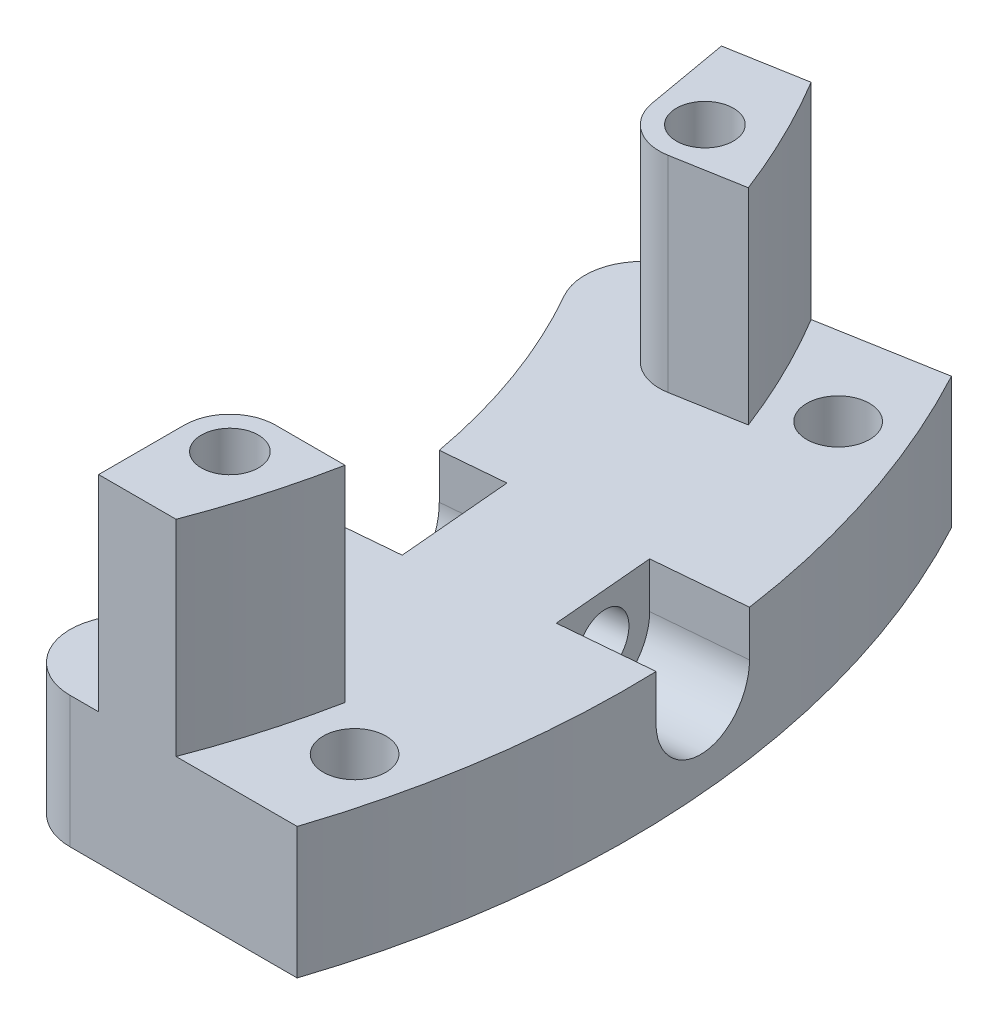
from build123d import *

# Parameters (mm, degrees)
BOSS_EXTRUDE1_DEPTH = 11.5
SKETCH4_R           = 4.5
CUT_EXTRUDE2_DEPTH  = 5
SKETCH5_R           = 2.75
CUT_EXTRUDE3_DEPTH  = 89.726115198
SKETCH6_R           = 2.5
CUT_EXTRUDE4_DEPTH  = 50.330582837
CUT_EXTRUDE5_DEPTH  = 8.2
CUT_EXTRUDE6_DEPTH  = 9
FILLET1_R           = 5.05
FILLET2_R           = 5
BOSS_EXTRUDE2_DEPTH = 18
SKETCH3_R           = 2.5
CUT_EXTRUDE1_DEPTH  = 4


with BuildPart() as part:
    # Sketch1 → Boss-Extrude1 (new body)
    with BuildSketch(Plane(origin=(0, 0, 0), x_dir=(1, 0, 0), z_dir=(0, 1, 0))):
        with BuildLine():
            Line((48.493420768, -25), (75.993420768, -25))
            ThreePointArc((75.993420768, -25), (79.695575847, 6.97245942), (70.497705508, 37.816312856))
            Line((70.497705508, 37.816312856), (43.415492301, 33.04098797))
            ThreePointArc((43.415492301, 33.04098797), (54.350723514, 4.755072162), (48.493420768, -25))
        make_face()
    extrude(amount=BOSS_EXTRUDE1_DEPTH)

    # Sketch4 → Cut-Extrude2 (cut)
    with BuildSketch(Plane.XZ):
        with Locations(Location((73.026415161, 17, 0), (0, 0, 270))):
            Circle(SKETCH4_R)
        with Locations(Location((68.964960805, -29.422635715, 0), (0, 0, 270))):
            Circle(SKETCH4_R)
    extrude(amount=-CUT_EXTRUDE2_DEPTH, mode=Mode.SUBTRACT)

    # Sketch5 → Cut-Extrude3 (cut, through all)
    with BuildSketch(Plane.XZ.offset(-5)):
        with Locations(Location((73.026415161, 17, 0), (0, 0, 270))):
            Circle(SKETCH5_R)
        with Locations(Location((68.964960805, -29.422635715, 0), (0, 0, 270))):
            Circle(SKETCH5_R)
    extrude(amount=-CUT_EXTRUDE3_DEPTH, mode=Mode.SUBTRACT)

    # Sketch6 → Cut-Extrude4 (cut, through all)
    with BuildSketch(Plane(origin=(45.954456534, 0, -4.020493985), x_dir=(0.08715574274765857, 0, 0.9961946980917455), z_dir=(-0.9961946980917455, 0, 0.08715574274765857))):
        with Locations((0, 7.5)):
            Circle(SKETCH6_R)
    extrude(amount=-CUT_EXTRUDE4_DEPTH, mode=Mode.SUBTRACT)

    # Sketch8 → Cut-Extrude5 (cut)
    with BuildSketch(Plane(origin=(79.695575847, 0, -6.97245942), x_dir=(-0.08715574274765857, 0, -0.9961946980917455), z_dir=(0.9961946980917455, 0, -0.08715574274765857))):
        with BuildLine():
            Line((-4.5, 7.5), (-4.5, 11.5))
            Line((-4.5, 11.5), (4.5, 11.5))
            Line((4.5, 11.5), (4.5, 7.5))
            ThreePointArc((4.5, 7.5), (0, 3), (-4.5, 7.5))
        make_face()
    extrude(amount=-CUT_EXTRUDE5_DEPTH, mode=Mode.SUBTRACT)

    # Sketch7 → Cut-Extrude6 (cut)
    with BuildSketch(Plane(origin=(0, 11.5, 0), x_dir=(1, 0, 0), z_dir=(0, 1, 0))):
        Polygon((51.16274886, 9.5454507), (52.043021862, -0.516115751), (60.012579447, 0.181130191), (59.132306445, 10.242696642), align=None)
    extrude(amount=-CUT_EXTRUDE6_DEPTH, mode=Mode.SUBTRACT)

    # Fillet1
    # the kernel refuses this fillet: 5.05 mm, written as the material it adds along each edge
    with BuildSketch(Plane(origin=(41.980572745, 2.5, 1.396465976), x_dir=(0, 1, 0), z_dir=(0.9961946980917454, 0, -0.08715574274765918))) as fillet1_piece_1_section:
        with BuildLine():
            CenterArc((FILLET1_R, -FILLET1_R), FILLET1_R, 90, 90)
            Line((0, -FILLET1_R), (0, 0))
            Line((0, 0), (FILLET1_R, 0))
        make_face()
    fillet1_piece_1 = extrude(amount=30.725886038, mode=Mode.PRIVATE)
    fillet1_piece_1 = fillet1_piece_1 - Plane(origin=(0, 3.651800065, 0), x_dir=(0.7957627874759549, 0, -0.6056084428642803), z_dir=(0, -1, 0)) * Cylinder(54.558334448, 82, mode=Mode.PRIVATE)
    add(fillet1_piece_1)
    with BuildSketch(Plane(origin=(71.709264508, 2.5, -11.343037894), x_dir=(0.08715574274765941, 0, 0.9961946980917454), z_dir=(-0.9961946980917455, 0, 0.08715574274765941))) as fillet1_piece_2_section:
        with BuildLine():
            CenterArc((FILLET1_R, FILLET1_R), FILLET1_R, 180, 90)
            Line((0, FILLET1_R), (0, 0))
            Line((0, 0), (FILLET1_R, 0))
        make_face()
    fillet1_piece_2 = extrude(amount=30.725886038, mode=Mode.PRIVATE)
    fillet1_piece_2 = fillet1_piece_2 - Plane(origin=(0, 3.643295327, 0), x_dir=(0.7957627874759549, 0, -0.6056084428642803), z_dir=(0, -1, 0)) * Cylinder(54.558334448, 82, mode=Mode.PRIVATE)
    add(fillet1_piece_2)

    # Fillet2
    fillet2_edges = [part.edges().sort_by_distance(p)[0] for p in [
        (48.493420768, 5.75, 25),
        (43.415492301, 5.75, -33.04098797),
    ]]
    fillet(fillet2_edges, radius=FILLET2_R)

    # Sketch2 → Boss-Extrude2 (add)
    with BuildSketch(Plane.XZ.offset(-11.5)):
        with BuildLine():
            Line((62.599920128, 13.5), (68.685879189, 13.5))
            ThreePointArc((68.685879189, 13.5), (67.280837144, 19.320687184), (65.383484153, 25))
            Line((65.383484153, 25), (58.599920128, 25))
            Line((58.599920128, 25), (58.599920128, 17.5))
            ThreePointArc((58.599920128, 17.5), (59.771493003, 14.671572875), (62.599920128, 13.5))
        make_face()
        with BuildLine():
            Line((54.670812559, -27.409905019), (53.368451226, -34.795963167))
            Line((53.368451226, -34.795963167), (60.048957671, -35.973916698))
            ThreePointArc((60.048957671, -35.973916698), (62.903687928, -30.710357294), (65.29813595, -25.222082418))
            Line((65.29813595, -25.222082418), (59.304636281, -24.165266718))
            ThreePointArc((59.304636281, -24.165266718), (56.315737825, -24.827889553), (54.670812559, -27.409905019))
        make_face()
    extrude(amount=-BOSS_EXTRUDE2_DEPTH)

    # Sketch3 → Cut-Extrude1 (cut)
    with BuildSketch(Plane(origin=(0, 29.5, 0), x_dir=(1, 0, 0), z_dir=(0, 1, 0))):
        with Locations(Location((58.610043571, 28.10449773, 0), (0, 0, 270))):
            Circle(SKETCH3_R)
        with Locations(Location((62.599920128, -17.5, 0), (0, 0, 270))):
            Circle(SKETCH3_R)
    extrude(amount=-CUT_EXTRUDE1_DEPTH, mode=Mode.SUBTRACT)


solid = part.part
